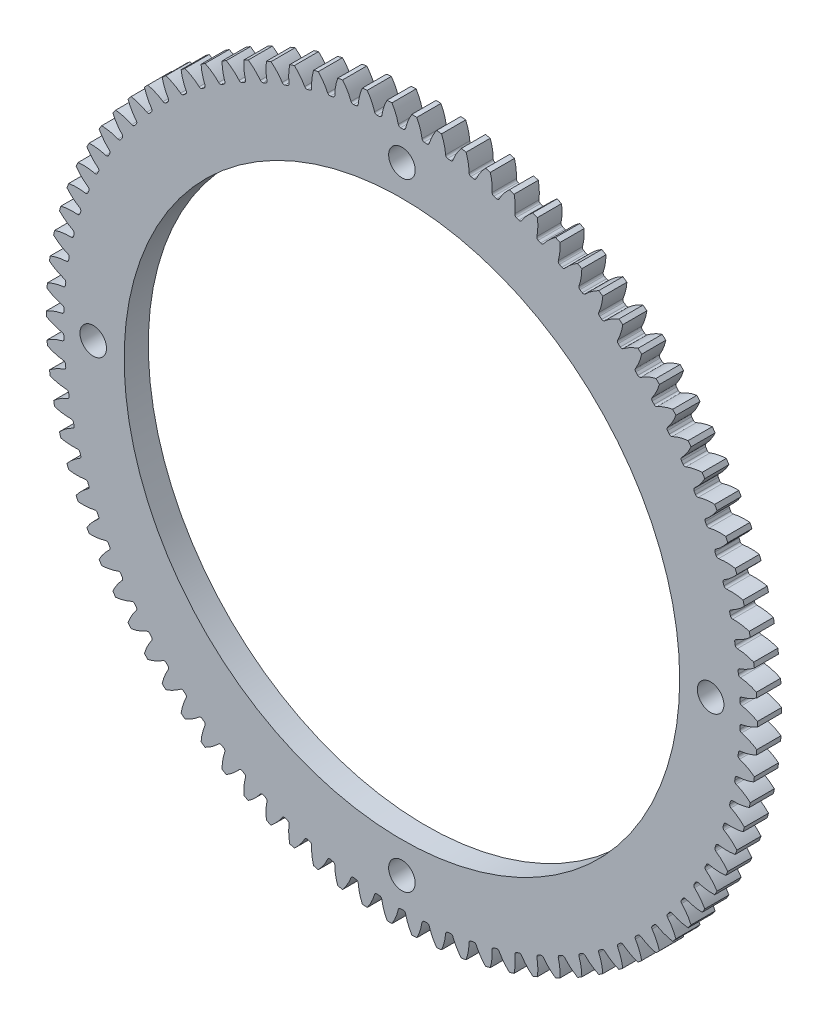
from build123d import *

# Parameters (mm, degrees)
SKETCH2_R                = 73.6
BOSS_EXTRUDE1_DEPTH      = 5
CUT_EXTRUDE1_DEPTH       = 25
FILLET1_R                = 0.48
CIRPATTERN1_COUNT        = 90
FILLET1_OF_CIRPATTERN1_R = 0.48
CUT_EXTRUDE2_DEPTH       = 105.185745275
CUT_EXTRUDE2_DEPTH_BACK  = 105.185745275
SKETCH4_R                = 4.1
SKETCH6_R                = 1.5
CUT_EXTRUDE4_DEPTH       = 105.185745275
CIRPATTERN2_COUNT        = 4
SKETCH7_R                = 16.5
CUT_EXTRUDE5_DEPTH       = 3.2
SKETCH8_R                = 57.5
CUT_EXTRUDE6_DEPTH       = 105.185745275
SKETCH10_R               = 2.75
CUT_EXTRUDE7_DEPTH       = 105.185745275
CIRPATTERN3_COUNT        = 4


with BuildPart() as part:
    # Sketch2 → Boss-Extrude1 (new body)
    with BuildSketch(Plane.XY):
        Circle(SKETCH2_R)
    extrude(amount=-BOSS_EXTRUDE1_DEPTH)

    # Sketch3 → Cut-Extrude1 (cut)
    with BuildSketch(Plane.XY):
        with BuildLine():
            ThreePointArc((0.678207963, 69.996714451), (0, 70), (-0.678207963, 69.996714451))
            ThreePointArc((-0.678207963, 69.996714451), (-1.20126782, 71.849201838), (-2.061676964, 73.571118573))
            ThreePointArc((-2.061676964, 73.571118573), (0, 73.6), (2.061676964, 73.571118573))
            ThreePointArc((2.061676964, 73.571118573), (1.20126782, 71.849201838), (0.678207963, 69.996714451))
        make_face()
    cut_extrude1 = extrude(amount=-CUT_EXTRUDE1_DEPTH, mode=Mode.SUBTRACT)

    # Fillet1
    fillet1_edges = [part.edges().sort_by_distance(p)[0] for p in [
        (0.678207963, 69.996714451, -2.5),
        (-0.678207963, 69.996714451, -2.5),
    ]]
    fillet(fillet1_edges, radius=FILLET1_R)

    # CirPattern1: Cut-Extrude1 ×90 about axis
    cirpattern1_axis = Axis((0, 0, 0), (0, 0, 1))
    for i in range(1, CIRPATTERN1_COUNT):
        add(cut_extrude1.rotate(cirpattern1_axis, i * 360 / CIRPATTERN1_COUNT), mode=Mode.SUBTRACT)

    # Fillet1 of CirPattern1
    fillet1_of_cirpattern1_edges = [part.edges().sort_by_distance(p)[0] for p in [
        (-4.206168091, 69.873515369, -2.5),
        (-5.559279856, 69.778896577, -2.5),
        (-9.070052118, 69.409899543, -2.5),
        (-10.413267497, 69.221122933, -2.5),
        (-13.889747762, 68.608125664, -2.5),
        (-15.216522745, 68.326110935, -2.5),
        (-18.641773951, 67.472099893, -2.5),
        (-19.945644624, 67.098220994, -2.5),
        (-23.302979291, 66.007356834, -2.5),
        (-24.577593327, 65.543435264, -2.5),
        (-27.850654858, 64.221032567, -2.5),
        (-29.089802466, 63.669328507, -2.5),
        (-32.262644835, 62.121829885, -2.5),
        (-33.460289012, 61.48503118, -2.5),
        (-36.517454449, 59.719975892, -2.5),
        (-37.667760392, 59.001184963, -2.5),
        (-40.594354696, 57.02717218, -2.5),
        (-41.691718231, 56.229890903, -2.5),
        (-44.473483327, 54.056537817, -2.5),
        (-45.512558209, 53.184650467, -2.5),
        (-48.135941618, 50.822545436, -2.5),
        (-49.111665579, 49.880299759, -2.5),
        (-51.563886439, 47.340950722, -2.5),
        (-52.47150585, 46.332937246, -2.5),
        (-54.74061719, 43.628715655, -2.5),
        (-55.57571022, 42.559845319, -2.5),
        (-57.650657155, 39.703925871, -2.5),
        (-58.409155315, 38.579406104, -2.5),
        (-60.279828915, 35.585702551, -2.5),
        (-60.958036878, 34.411011901, -2.5),
        (-62.615323407, 31.294109265, -2.5),
        (-63.209937012, 30.074970706, -2.5),
        (-64.645762337, 26.850054224, -2.5),
        (-65.153884686, 25.592407278, -2.5),
        (-66.361253612, 22.275188418, -2.5),
        (-66.780409184, 20.985160213, -2.5),
        (-67.753439529, 17.591800134, -2.5),
        (-68.081586241, 16.275675558, -2.5),
        (-68.8155375, 12.822706367, -2.5),
        (-69.051076654, 11.486897447, -2.5),
        (-69.542373089, 7.991141664, -2.5),
        (-69.684157162, 6.642156327, -2.5),
        (-69.930405227, 3.120644922, -2.5),
        (-69.977743461, 1.765055288, -2.5),
        (-69.977743461, -1.765055288, -2.5),
        (-69.930405227, -3.120644922, -2.5),
        (-69.684157162, -6.642156327, -2.5),
        (-69.542373089, -7.991141664, -2.5),
        (-69.051076654, -11.486897447, -2.5),
        (-68.8155375, -12.822706367, -2.5),
        (-68.081586241, -16.275675558, -2.5),
        (-67.753439529, -17.591800134, -2.5),
        (-66.780409184, -20.985160213, -2.5),
        (-66.361253612, -22.275188418, -2.5),
        (-65.153884686, -25.592407278, -2.5),
        (-64.645762337, -26.850054224, -2.5),
        (-63.209937012, -30.074970706, -2.5),
        (-62.615323407, -31.294109265, -2.5),
        (-60.958036878, -34.411011901, -2.5),
        (-60.279828915, -35.585702551, -2.5),
        (-58.409155315, -38.579406104, -2.5),
        (-57.650657155, -39.703925871, -2.5),
        (-55.57571022, -42.559845319, -2.5),
        (-54.74061719, -43.628715655, -2.5),
        (-52.47150585, -46.332937246, -2.5),
        (-51.563886439, -47.340950722, -2.5),
        (-49.111665579, -49.880299759, -2.5),
        (-48.135941618, -50.822545436, -2.5),
        (-45.512558209, -53.184650467, -2.5),
        (-44.473483327, -54.056537817, -2.5),
        (-41.691718231, -56.229890903, -2.5),
        (-40.594354696, -57.02717218, -2.5),
        (-37.667760392, -59.001184963, -2.5),
        (-36.517454449, -59.719975892, -2.5),
        (-33.460289012, -61.48503118, -2.5),
        (-32.262644835, -62.121829885, -2.5),
        (-29.089802466, -63.669328507, -2.5),
        (-27.850654858, -64.221032567, -2.5),
        (-24.577593327, -65.543435264, -2.5),
        (-23.302979291, -66.007356834, -2.5),
        (-19.945644624, -67.098220994, -2.5),
        (-18.641773951, -67.472099893, -2.5),
        (-15.216522745, -68.326110935, -2.5),
        (-13.889747762, -68.608125664, -2.5),
        (-10.413267497, -69.221122933, -2.5),
        (-9.070052118, -69.409899543, -2.5),
        (-5.559279856, -69.778896577, -2.5),
        (-4.206168091, -69.873515369, -2.5),
        (-0.678207963, -69.996714451, -2.5),
        (0.678207963, -69.996714451, -2.5),
        (4.206168091, -69.873515369, -2.5),
        (5.559279856, -69.778896577, -2.5),
        (9.070052118, -69.409899543, -2.5),
        (10.413267497, -69.221122933, -2.5),
        (13.889747762, -68.608125664, -2.5),
        (15.216522745, -68.326110935, -2.5),
        (18.641773951, -67.472099893, -2.5),
        (19.945644624, -67.098220994, -2.5),
        (23.302979291, -66.007356834, -2.5),
        (24.577593327, -65.543435264, -2.5),
        (27.850654858, -64.221032567, -2.5),
        (29.089802466, -63.669328507, -2.5),
        (32.262644835, -62.121829885, -2.5),
        (33.460289012, -61.48503118, -2.5),
        (36.517454449, -59.719975892, -2.5),
        (37.667760392, -59.001184963, -2.5),
        (40.594354696, -57.02717218, -2.5),
        (41.691718231, -56.229890903, -2.5),
        (44.473483327, -54.056537817, -2.5),
        (45.512558209, -53.184650467, -2.5),
        (48.135941618, -50.822545436, -2.5),
        (49.111665579, -49.880299759, -2.5),
        (51.563886439, -47.340950722, -2.5),
        (52.47150585, -46.332937246, -2.5),
        (54.74061719, -43.628715655, -2.5),
        (55.57571022, -42.559845319, -2.5),
        (57.650657155, -39.703925871, -2.5),
        (58.409155315, -38.579406104, -2.5),
        (60.279828915, -35.585702551, -2.5),
        (60.958036878, -34.411011901, -2.5),
        (62.615323407, -31.294109265, -2.5),
        (63.209937012, -30.074970706, -2.5),
        (64.645762337, -26.850054224, -2.5),
        (65.153884686, -25.592407278, -2.5),
        (66.361253612, -22.275188418, -2.5),
        (66.780409184, -20.985160213, -2.5),
        (67.753439529, -17.591800134, -2.5),
        (68.081586241, -16.275675558, -2.5),
        (68.8155375, -12.822706367, -2.5),
        (69.051076654, -11.486897447, -2.5),
        (69.542373089, -7.991141664, -2.5),
        (69.684157162, -6.642156327, -2.5),
        (69.930405227, -3.120644922, -2.5),
        (69.977743461, -1.765055288, -2.5),
        (69.977743461, 1.765055288, -2.5),
        (69.930405227, 3.120644922, -2.5),
        (69.684157162, 6.642156327, -2.5),
        (69.542373089, 7.991141664, -2.5),
        (69.051076654, 11.486897447, -2.5),
        (68.8155375, 12.822706367, -2.5),
        (68.081586241, 16.275675558, -2.5),
        (67.753439529, 17.591800134, -2.5),
        (66.780409184, 20.985160213, -2.5),
        (66.361253612, 22.275188418, -2.5),
        (65.153884686, 25.592407278, -2.5),
        (64.645762337, 26.850054224, -2.5),
        (63.209937012, 30.074970706, -2.5),
        (62.615323407, 31.294109265, -2.5),
        (60.958036878, 34.411011901, -2.5),
        (60.279828915, 35.585702551, -2.5),
        (58.409155315, 38.579406104, -2.5),
        (57.650657155, 39.703925871, -2.5),
        (55.57571022, 42.559845319, -2.5),
        (54.74061719, 43.628715655, -2.5),
        (52.47150585, 46.332937246, -2.5),
        (51.563886439, 47.340950722, -2.5),
        (49.111665579, 49.880299759, -2.5),
        (48.135941618, 50.822545436, -2.5),
        (45.512558209, 53.184650467, -2.5),
        (44.473483327, 54.056537817, -2.5),
        (41.691718231, 56.229890903, -2.5),
        (40.594354696, 57.02717218, -2.5),
        (37.667760392, 59.001184963, -2.5),
        (36.517454449, 59.719975892, -2.5),
        (33.460289012, 61.48503118, -2.5),
        (32.262644835, 62.121829885, -2.5),
        (29.089802466, 63.669328507, -2.5),
        (27.850654858, 64.221032567, -2.5),
        (24.577593327, 65.543435264, -2.5),
        (23.302979291, 66.007356834, -2.5),
        (19.945644624, 67.098220994, -2.5),
        (18.641773951, 67.472099893, -2.5),
        (15.216522745, 68.326110935, -2.5),
        (13.889747762, 68.608125664, -2.5),
        (10.413267497, 69.221122933, -2.5),
        (9.070052118, 69.409899543, -2.5),
        (5.559279856, 69.778896577, -2.5),
        (4.206168091, 69.873515369, -2.5),
    ]]
    fillet(fillet1_of_cirpattern1_edges, radius=FILLET1_OF_CIRPATTERN1_R)

    # Sketch4 → Cut-Extrude2 (cut, two sides: drawn at the far end of the back side and taken through both)
    with BuildSketch(Plane.XY.offset(-CUT_EXTRUDE2_DEPTH_BACK)):
        Circle(SKETCH4_R)
    extrude(amount=CUT_EXTRUDE2_DEPTH + CUT_EXTRUDE2_DEPTH_BACK, mode=Mode.SUBTRACT)

    # Sketch6 → Cut-Extrude4 (cut, symmetric)
    with BuildSketch(Plane.XY):
        with Locations((0, 12)):
            Circle(SKETCH6_R)
    cut_extrude4 = extrude(amount=CUT_EXTRUDE4_DEPTH, both=True, mode=Mode.SUBTRACT)

    # CirPattern2: Cut-Extrude4 ×4 about axis
    cirpattern2_axis = Axis((0, 0, 0), (0, 0, 1))
    for i in range(1, CIRPATTERN2_COUNT):
        add(cut_extrude4.rotate(cirpattern2_axis, i * 360 / CIRPATTERN2_COUNT), mode=Mode.SUBTRACT)

    # Sketch7 → Cut-Extrude5 (cut)
    with BuildSketch(Plane.XY):
        Circle(SKETCH7_R)
    extrude(amount=-CUT_EXTRUDE5_DEPTH, mode=Mode.SUBTRACT)

    # Sketch8 → Cut-Extrude6 (cut, through all)
    with BuildSketch(Plane.XY):
        Circle(SKETCH8_R)
    extrude(amount=-CUT_EXTRUDE6_DEPTH, mode=Mode.SUBTRACT)

    # Sketch10 → Cut-Extrude7 (cut, through all)
    with BuildSketch(Plane.XY):
        with Locations((0, 63.9)):
            Circle(SKETCH10_R)
    cut_extrude7 = extrude(amount=-CUT_EXTRUDE7_DEPTH, mode=Mode.SUBTRACT)

    # CirPattern3: Cut-Extrude7 ×4 about axis
    cirpattern3_axis = Axis((0, 0, 0), (0, 0, 1))
    for i in range(1, CIRPATTERN3_COUNT):
        add(cut_extrude7.rotate(cirpattern3_axis, i * 360 / CIRPATTERN3_COUNT), mode=Mode.SUBTRACT)


solid = part.part
